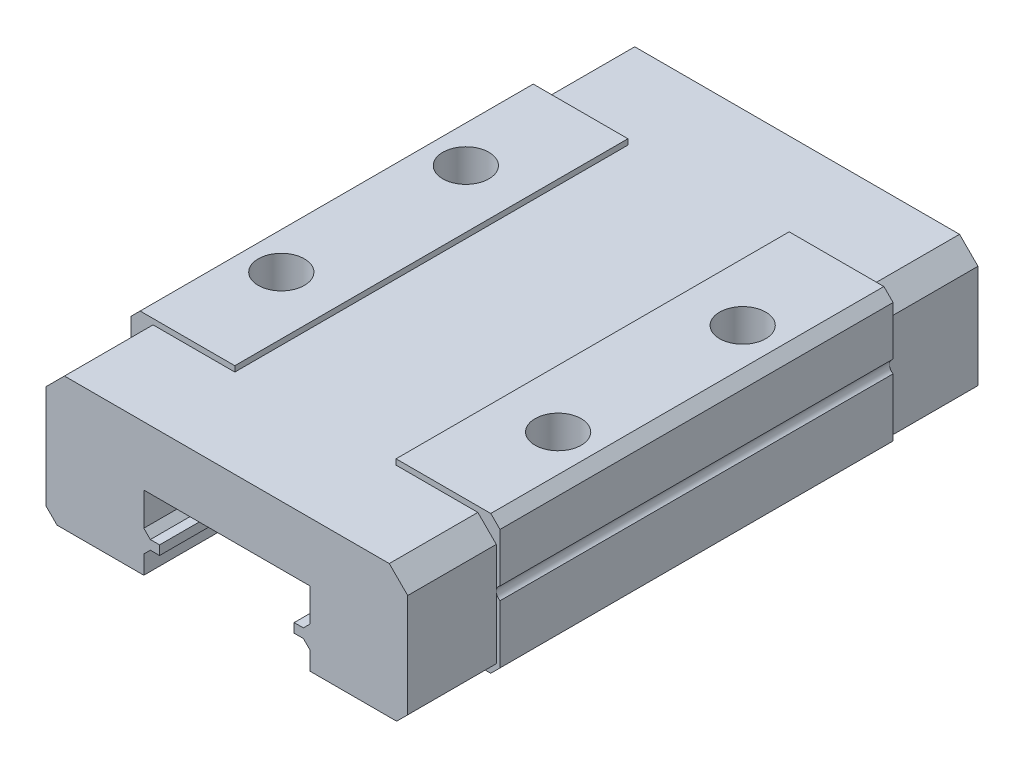
from build123d import *

# Parameters (mm, degrees)
EXTRUDE_1_DEPTH     = 30.9
CHAMFER_1_SIZE      = 0.5
CUT_EXTRUDE_1_DEPTH = 0.3
SKETCH_6_W          = 0.2
SKETCH_6_H          = 4.8
CUT_EXTRUDE_2_DEPTH = 8.3
CHAMFER_2_SIZE      = 1
CHAMFER_3_SIZE      = 0.6
CHAMFER_4_SIZE      = 0.5
SKETCH_7_R          = 0.4
CUT_EXTRUDE_3_DEPTH = 21.3


with BuildPart() as part:
    # 草图1 → 凸台-拉伸1 (new body)
    with BuildSketch(Plane.XY):
        Polygon((-10, 0), (-10, 7.5), (10, 7.5), (10, 0), (4.5, 0), (4.5, 1), (4.146446609, 1.353553391), (3.646446609, 1.353553391), (3.646446609, 1.853553391), (4.146446609, 1.853553391), (4.5, 2.207106781), (4.5, 4), (-4.5, 4), (-4.5, 2.207106781), (-4.146446609, 1.853553391), (-3.646446609, 1.853553391), (-3.646446609, 1.353553391), (-4.146446609, 1.353553391), (-4.5, 1), (-4.5, 0), align=None)
    extrude(amount=-EXTRUDE_1_DEPTH)

    # 草图3 → M3 螺纹孔1 (revolve, cut)
    with BuildSketch(Plane(origin=(7.5, 7.5, -20.45), x_dir=(0, 0, 1), z_dir=(1, 0, 0))):
        Polygon((0, 0), (0, 3.751075774), (1.25, 3), (1.25, 0), align=None)
    hole_wizard_m3_1 = revolve(axis=Axis((7.5, 13.85, -20.45), (0, -1, 0)), mode=Mode.SUBTRACT)

    # 镜向1: M3 螺纹孔1 across plane
    add(hole_wizard_m3_1.mirror(Plane(origin=(0, 0, -15.45), x_dir=(1, 0, 0), z_dir=(0, 0, -1))), mode=Mode.SUBTRACT)

    # 镜向2: M3 螺纹孔1 across plane
    add(hole_wizard_m3_1.mirror(Plane.ZY), mode=Mode.SUBTRACT)

    # 镜向2 copy 1 sketch → 镜向2 copy 1 (revolve, cut)
    with BuildSketch(Plane(origin=(-7.5, 7.5, -10.45), x_dir=(0, 0, -1), z_dir=(-1, 0, 0))):
        Polygon((0, 0), (0, 3.751075774), (1.25, 3), (1.25, 0), align=None)
    revolve(axis=Axis((-7.5, 13.85, -10.45), (0, -1, 0)), mode=Mode.SUBTRACT)

    # 倒角1
    chamfer_1_edges = [part.edges().sort_by_distance(p)[0] for p in [
        (10, 7.5, -15.45),
        (-10, 7.5, -15.45),
    ]]
    chamfer(chamfer_1_edges, length=CHAMFER_1_SIZE)

    # 草图5 → 切除-拉伸1 (cut)
    with BuildSketch(Plane(origin=(0, 7.5, 0), x_dir=(1, 0, 0), z_dir=(0, 1, 0))):
        Polygon((-9.5, 26.1), (-4.368581018, 26.1), (-4.368581018, 4.8), (-9.5, 4.8), (-10, 4.8), (-10, 0), (10, 0), (10, 4.8), (9.5, 4.8), (4.368581018, 4.8), (4.368581018, 26.1), (9.5, 26.1), (10, 26.1), (10, 30.9), (-10, 30.9), (-10, 26.1), align=None)
    extrude(amount=-CUT_EXTRUDE_1_DEPTH, mode=Mode.SUBTRACT)

    # 草图6 → 切除-拉伸2 (cut)
    with BuildSketch(Plane(origin=(0, 7.2, 0), x_dir=(1, 0, 0), z_dir=(0, 1, 0))):
        with Locations((-9.9, 28.5)):
            Rectangle(SKETCH_6_W, SKETCH_6_H)
        with Locations((9.9, 28.5)):
            Rectangle(SKETCH_6_W, SKETCH_6_H)
        with Locations((9.9, 2.4)):
            Rectangle(SKETCH_6_W, SKETCH_6_H)
        with Locations((-9.9, 2.4)):
            Rectangle(SKETCH_6_W, SKETCH_6_H)
    extrude(amount=-CUT_EXTRUDE_2_DEPTH, mode=Mode.SUBTRACT)

    # 倒角2
    # the kernel refuses this chamfer: 1 mm, written as the material it takes off along each edge
    with BuildSketch(Plane(origin=(-9.8, 7.2, -4.8), x_dir=(-0.027495876610583895, -0.9996219169112968, 0), z_dir=(0, 0, 1)), Plane(origin=(-9.8, 7.2, -33.471682988), x_dir=(-0.027495876610585623, -0.9996219169112968, 0), z_dir=(0, 0, 1))) as chamfer_2_piece_1:
        Polygon((CHAMFER_2_SIZE * 0.999621916911, CHAMFER_2_SIZE * 0.0274958766106), (-CHAMFER_2_SIZE * 0.0274958766106, CHAMFER_2_SIZE * 0.999621916911), (0, 0), align=None)
    extrude(amount=7.371682988, mode=Mode.SUBTRACT)
    with BuildSketch(Plane(origin=(9.8, 7.2, 2.571682988), x_dir=(-0.9996219169112968, 0.02749587661058651, 0), z_dir=(0, 0, -1)), Plane(origin=(9.8, 7.2, -26.1), x_dir=(-0.9996219169112968, 0.02749587661058651, 0), z_dir=(0, 0, -1))) as chamfer_2_piece_2:
        Polygon((CHAMFER_2_SIZE * 0.999621916911, -CHAMFER_2_SIZE * 0.0274958766106), (-CHAMFER_2_SIZE * 0.0274958766106, -CHAMFER_2_SIZE * 0.999621916911), (0, 0), align=None)
    extrude(amount=7.371682988, mode=Mode.SUBTRACT)

    # 倒角3
    chamfer_3_edges = [part.edges().sort_by_distance(p)[0] for p in [
        (-9.8, 0, -28.5),
        (9.8, 0, -28.5),
        (9.8, 0, -2.4),
        (-9.8, 0, -2.4),
    ]]
    chamfer(chamfer_3_edges, length=CHAMFER_3_SIZE)

    # 倒角4
    chamfer_4_edges = [part.edges().sort_by_distance(p)[0] for p in [
        (-10, 0, -15.45),
        (10, 0, -15.45),
    ]]
    chamfer(chamfer_4_edges, length=CHAMFER_4_SIZE)

    # 草图7 → 切除-拉伸3 (cut)
    with BuildSketch(Plane(origin=(0, 0, -26.1), x_dir=(-1, 0, 0), z_dir=(0, 0, -1))):
        with Locations((-10.2, 4)):
            Circle(SKETCH_7_R)
    extrude(amount=-CUT_EXTRUDE_3_DEPTH, mode=Mode.SUBTRACT)


solid = part.part
